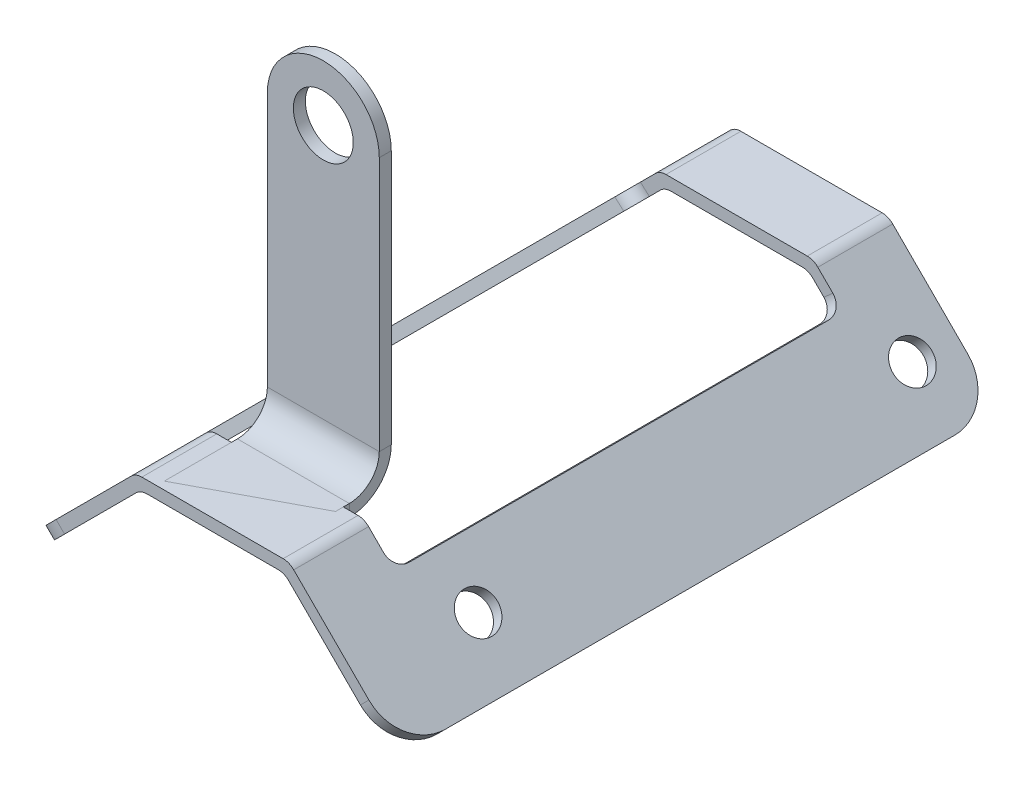
from build123d import *

# Parameters (mm, degrees)
BOSS_EXTRUDE1_DEPTH          = 200
FILLET3_R                    = 5
CUT_EXTRUDE1_DEPTH           = 150
SKETCH5_W                    = 37.37
SKETCH5_H                    = 41
BASE_FLANGE1_DEPTH           = 4
EDGE_FLANGE1_STRIP_W         = 36
EDGE_FLANGE1_STRIP_H         = 4
EDGE_FLANGE1_STRIP_CUT_DEPTH = 37.37
EDGE_FLANGE1_DEPTH           = 37.37
EDGE_FLANGE1_PROFILE_R       = 10
EDGE_FLANGE1_FLAT_DEPTH      = 4
SKETCH21_R                   = 6.5
CUT_EXTRUDE3_DEPTH           = 254.288349545
FILLET4_R                    = 5
FILLET5_R                    = 15


# Sheet-metal steps are written as plain solids
with BuildPart() as part:
    # Sketch1 → Boss-Extrude1 (new body)
    with BuildSketch(Plane.XY):
        Polygon((24, 37.832514472), (-24, 37.832514472), (-60, 1.832514472), (-62.828427125, 4.660941596), (-25.656854249, 41.832514472), (25.656854249, 41.832514472), (62.828427125, 4.660941596), (60, 1.832514472), align=None)
    extrude(amount=-BOSS_EXTRUDE1_DEPTH)

    # Fillet3
    fillet3_edges = [part.edges().sort_by_distance(p)[0] for p in [
        (-25.656854249, 41.832514472, -100),
        (25.656854249, 41.832514472, -100),
        (24, 37.832514472, -100),
        (-24, 37.832514472, -100),
    ]]
    fillet(fillet3_edges, radius=FILLET3_R)

    # Sketch4 → Cut-Extrude1 (cut)
    with BuildSketch(Plane.XY.offset(-25)):
        Polygon((0, 0), (-80.502525317, 71.832514472), (80.502525317, 71.832514472), align=None)
    extrude(amount=-CUT_EXTRUDE1_DEPTH, mode=Mode.SUBTRACT)

    # Sketch21 → Cut-Extrude3 (cut, through all)
    with BuildSketch(Plane(origin=(33.744684361, 33.744684361, 0), x_dir=(0, 0, -1), z_dir=(0.7071067811865477, 0.7071067811865475, 0))):
        with Locations(Location((185, -21.130623462, 0), (0, 0, 90))):
            Circle(SKETCH21_R)
        with Locations(Location((40, -21.130623462, 0), (0, 0, 90))):
            Circle(SKETCH21_R)
    cut_extrude3 = extrude(amount=-CUT_EXTRUDE3_DEPTH, mode=Mode.SUBTRACT)

    # Mirror1: Cut-Extrude3 across plane
    add(cut_extrude3.mirror(Plane(origin=(0, 0, 0), x_dir=(0, 0, 1), z_dir=(1, 0, 0))), mode=Mode.SUBTRACT)

    # Fillet4
    fillet4_edges = [part.edges().sort_by_distance(p)[0] for p in [
        (34.170530267, 30.490411329, -25),
        (-34.170530267, 30.490411329, -25),
        (-34.170530267, 30.490411329, -175),
        (34.170530267, 30.490411329, -175),
    ]]
    fillet(fillet4_edges, radius=FILLET4_R)

    # Fillet5
    fillet5_edges = [part.edges().sort_by_distance(p)[0] for p in [
        (61.414213562, 3.246728034, 0),
        (61.414213562, 3.246728034, -200),
        (-61.414213562, 3.246728034, -200),
        (-61.414213562, 3.246728034, 0),
    ]]
    fillet(fillet5_edges, radius=FILLET5_R)


with BuildPart() as body_2:
    # Sketch5 → Base-Flange1 (new body)
    with BuildSketch(Plane(origin=(0, 41.832514472, 0), x_dir=(1, 0, 0), z_dir=(0, 1, 0))):
        with Locations((0, 20.5)):
            Rectangle(SKETCH5_W, SKETCH5_H)
    extrude(amount=-BASE_FLANGE1_DEPTH)

    # Edge-Flange1 strip (across the edge) → Edge-Flange1 strip cut (cut)
    with BuildSketch(Plane(origin=(18.685, 41.832514472, -41), x_dir=(0, 0, 1), z_dir=(-1, 0, 0))):
        with Locations((-4, -2)):
            Rectangle(EDGE_FLANGE1_STRIP_W, EDGE_FLANGE1_STRIP_H)
    extrude(amount=EDGE_FLANGE1_STRIP_CUT_DEPTH, mode=Mode.SUBTRACT)

    # Edge-Flange1 bend section (across the edge) → Edge-Flange1 (add)
    with BuildSketch(Plane(origin=(18.685, 41.832514472, -41), x_dir=(0, 0, 1), z_dir=(-1, 0, 0))):
        with BuildLine():
            Line((0, 10), (4, 10))
            ThreePointArc((4, 10), (6.928932188, 2.928932188), (14, 0))
            Line((14, 0), (14, -4))
            ThreePointArc((14, -4), (4.100505063, 0.100505063), (0, 10))
        make_face()
    extrude(amount=EDGE_FLANGE1_DEPTH)

    # Edge-Flange1 profile (on flange) → Edge-Flange1 flat (add)
    with BuildSketch(Plane(origin=(0, 41.832514472, -41), x_dir=(-1, 0, 0), z_dir=(0, 0, -1))):
        with BuildLine():
            ThreePointArc((18.685, 95), (0, 113.685), (-18.685, 95))
            Line((-18.685, 95), (-18.685, 10))
            Line((-18.685, 10), (18.685, 10))
            Line((18.685, 10), (18.685, 95))
        make_face()
        with Locations((0, 95)):
            Circle(EDGE_FLANGE1_PROFILE_R, mode=Mode.SUBTRACT)
    extrude(amount=-EDGE_FLANGE1_FLAT_DEPTH)


solid = Compound([part.part, body_2.part])
